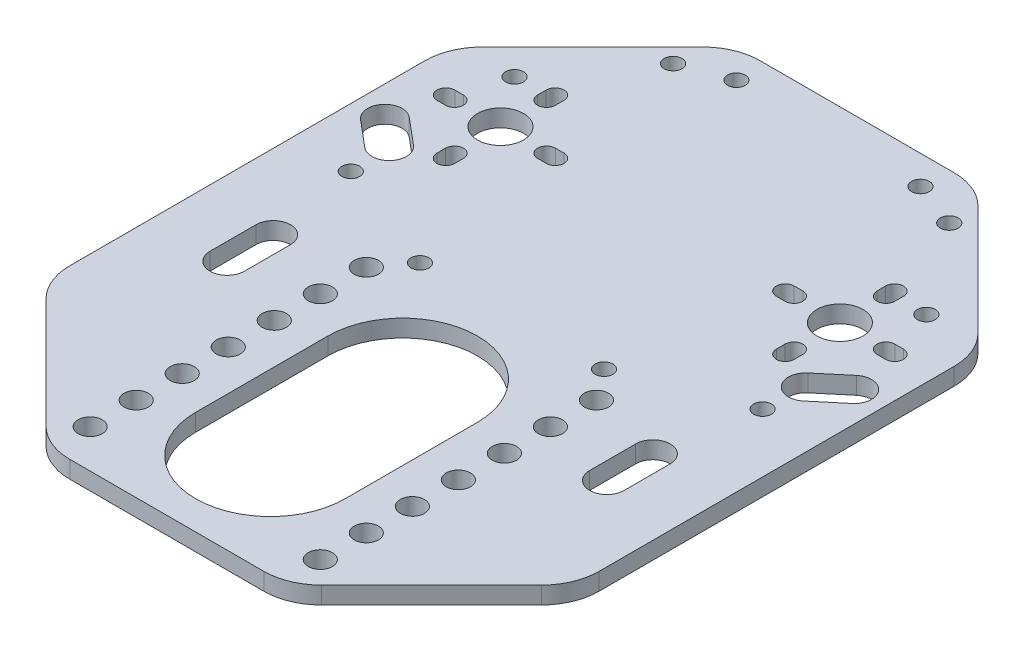
from build123d import *

# Parameters (mm, degrees)
SKETCH1_W           = 92
SKETCH1_H           = 186.23
SKETCH1_R           = 4
SKETCH1_R_2         = 1.55
BOSS_EXTRUDE1_DEPTH = 3
CHAMFER1_SIZE       = 25
FILLET1_R           = 10
SKETCH_2_R          = 2.1
CUT_EXTRUDE_2_DEPTH = 10
CUT_EXTRUDE_3_DEPTH = 10
CHAMFER_1_SIZE      = 25
FILLET_1_R          = 10
SKETCH_6_R          = 1.55
CUT_EXTRUDE_4_DEPTH = 10


with BuildPart() as part:
    # Sketch1 → Boss-Extrude1 (new body)
    with BuildSketch(Plane(origin=(0, 0, 0), x_dir=(1, 0, 0), z_dir=(0, 1, 0))):
        with Locations((0, -60.615)):
            Rectangle(SKETCH1_W, SKETCH1_H)
        with Locations((29.5, 0)):
            Circle(SKETCH1_R, mode=Mode.SUBTRACT)
        with Locations((-29.5, 0)):
            Circle(SKETCH1_R, mode=Mode.SUBTRACT)
        with Locations((16, 27.5)):
            Circle(SKETCH1_R_2, mode=Mode.SUBTRACT)
        with Locations((16, -27.5)):
            Circle(SKETCH1_R_2, mode=Mode.SUBTRACT)
        with Locations((-16, -27.5)):
            Circle(SKETCH1_R_2, mode=Mode.SUBTRACT)
        with Locations((-16, 27.5)):
            Circle(SKETCH1_R_2, mode=Mode.SUBTRACT)
        with Locations((40.79, -100.27)):
            Circle(SKETCH1_R_2, mode=Mode.SUBTRACT)
        with Locations((40.79, -128.73)):
            Circle(SKETCH1_R_2, mode=Mode.SUBTRACT)
        with Locations((-30.79, -128.73)):
            Circle(SKETCH1_R_2, mode=Mode.SUBTRACT)
        with Locations((-30.79, -100.27)):
            Circle(SKETCH1_R_2, mode=Mode.SUBTRACT)
        with Locations((24, 24.5)):
            Circle(SKETCH1_R_2, mode=Mode.SUBTRACT)
        with Locations((-24, 24.5)):
            Circle(SKETCH1_R_2, mode=Mode.SUBTRACT)
        with Locations((41, -146.73)):
            Circle(SKETCH1_R_2, mode=Mode.SUBTRACT)
        with Locations((-41, -146.73)):
            Circle(SKETCH1_R_2, mode=Mode.SUBTRACT)
        with BuildLine():
            Line((37.5, 1.55), (39, 1.55))
            ThreePointArc((39, 1.55), (40.55, 0), (39, -1.55))
            Line((39, -1.55), (37.5, -1.55))
            ThreePointArc((37.5, -1.55), (35.95, 0), (37.5, 1.55))
        make_face(mode=Mode.SUBTRACT)
        with BuildLine():
            Line((31.05, -8), (31.05, -9.5))
            ThreePointArc((31.05, -9.5), (29.5, -11.05), (27.95, -9.5))
            Line((27.95, -9.5), (27.95, -8))
            ThreePointArc((27.95, -8), (29.5, -6.45), (31.05, -8))
        make_face(mode=Mode.SUBTRACT)
        with BuildLine():
            Line((21.5, -1.55), (20, -1.55))
            ThreePointArc((20, -1.55), (18.45, 0), (20, 1.55))
            Line((20, 1.55), (21.5, 1.55))
            ThreePointArc((21.5, 1.55), (23.05, 0), (21.5, -1.55))
        make_face(mode=Mode.SUBTRACT)
        with BuildLine():
            Line((27.95, 8), (27.95, 9.5))
            ThreePointArc((27.95, 9.5), (29.5, 11.05), (31.05, 9.5))
            Line((31.05, 9.5), (31.05, 8))
            ThreePointArc((31.05, 8), (29.5, 6.45), (27.95, 8))
        make_face(mode=Mode.SUBTRACT)
        with BuildLine():
            Line((-27.95, 8), (-27.95, 9.5))
            ThreePointArc((-27.95, 9.5), (-29.5, 11.05), (-31.05, 9.5))
            Line((-31.05, 9.5), (-31.05, 8))
            ThreePointArc((-31.05, 8), (-29.5, 6.45), (-27.95, 8))
        make_face(mode=Mode.SUBTRACT)
        with BuildLine():
            Line((-21.5, -1.55), (-20, -1.55))
            ThreePointArc((-20, -1.55), (-18.45, 0), (-20, 1.55))
            Line((-20, 1.55), (-21.5, 1.55))
            ThreePointArc((-21.5, 1.55), (-23.05, 0), (-21.5, -1.55))
        make_face(mode=Mode.SUBTRACT)
        with BuildLine():
            Line((-31.05, -8), (-31.05, -9.5))
            ThreePointArc((-31.05, -9.5), (-29.5, -11.05), (-27.95, -9.5))
            Line((-27.95, -9.5), (-27.95, -8))
            ThreePointArc((-27.95, -8), (-29.5, -6.45), (-31.05, -8))
        make_face(mode=Mode.SUBTRACT)
        with BuildLine():
            Line((-37.5, 1.55), (-39, 1.55))
            ThreePointArc((-39, 1.55), (-40.55, 0), (-39, -1.55))
            Line((-39, -1.55), (-37.5, -1.55))
            ThreePointArc((-37.5, -1.55), (-35.95, 0), (-37.5, 1.55))
        make_face(mode=Mode.SUBTRACT)
        with BuildLine():
            Line((13, -46.5), (13, -69.5))
            ThreePointArc((13, -69.5), (0, -82.5), (-13, -69.5))
            Line((-13, -69.5), (-13, -46.5))
            ThreePointArc((-13, -46.5), (0, -33.5), (13, -46.5))
        make_face(mode=Mode.SUBTRACT)
        with BuildLine():
            Line((42.725522694, -11.094392704), (38.129256035, -14.951118362))
            ThreePointArc((38.129256035, -14.951118362), (33.902759877, -14.581347862), (34.272530377, -10.354851703))
            Line((34.272530377, -10.354851703), (38.868797036, -6.498126045))
            ThreePointArc((38.868797036, -6.498126045), (43.095293194, -6.867896546), (42.725522694, -11.094392704))
        make_face(mode=Mode.SUBTRACT)
        with BuildLine():
            Line((-42.725522694, -11.094392704), (-38.129256035, -14.951118362))
            ThreePointArc((-38.129256035, -14.951118362), (-33.902759877, -14.581347862), (-34.272530377, -10.354851703))
            Line((-34.272530377, -10.354851703), (-38.868797036, -6.498126045))
            ThreePointArc((-38.868797036, -6.498126045), (-43.095293194, -6.867896546), (-42.725522694, -11.094392704))
        make_face(mode=Mode.SUBTRACT)
        with BuildLine():
            Line((36, -36), (36, -44))
            ThreePointArc((36, -44), (33, -47), (30, -44))
            Line((30, -44), (30, -36))
            ThreePointArc((30, -36), (33, -33), (36, -36))
        make_face(mode=Mode.SUBTRACT)
        with BuildLine():
            Line((-36, -36), (-36, -44))
            ThreePointArc((-36, -44), (-33, -47), (-30, -44))
            Line((-30, -44), (-30, -36))
            ThreePointArc((-30, -36), (-33, -33), (-36, -36))
        make_face(mode=Mode.SUBTRACT)
        with BuildLine():
            Line((15, -148.18), (35, -148.18))
            ThreePointArc((35, -148.18), (36.55, -149.73), (35, -151.28))
            Line((35, -151.28), (15, -151.28))
            ThreePointArc((15, -151.28), (13.45, -149.73), (15, -148.18))
        make_face(mode=Mode.SUBTRACT)
        with BuildLine():
            Line((-15, -148.18), (-35, -148.18))
            ThreePointArc((-35, -148.18), (-36.55, -149.73), (-35, -151.28))
            Line((-35, -151.28), (-15, -151.28))
            ThreePointArc((-15, -151.28), (-13.45, -149.73), (-15, -148.18))
        make_face(mode=Mode.SUBTRACT)
    extrude(amount=BOSS_EXTRUDE1_DEPTH)

    # Chamfer1
    chamfer1_edges = [part.edges().sort_by_distance(p)[0] for p in [
        (46, 1.5, -32.5),
        (-46, 1.5, -32.5),
    ]]
    chamfer(chamfer1_edges, length=CHAMFER1_SIZE)

    # Fillet1
    fillet1_edges = [part.edges().sort_by_distance(p)[0] for p in [
        (-46, 1.5, 153.73),
        (46, 1.5, 153.73),
        (46, 1.5, -7.5),
        (21, 1.5, -32.5),
        (-46, 1.5, -7.5),
        (-21, 1.5, -32.5),
    ]]
    fillet(fillet1_edges, radius=FILLET1_R)

    # 草图2 → 切除-拉伸2 (cut)
    with BuildSketch(Plane(origin=(0, 3, 0), x_dir=(1, 0, 0), z_dir=(0, 1, 0))):
        with Locations((-20, -56.821452148)):
            Circle(SKETCH_2_R)
        with Locations((-20, -48.821452148)):
            Circle(SKETCH_2_R)
        with Locations((-20, -40.821452148)):
            Circle(SKETCH_2_R)
        with Locations((-20, -32.821452148)):
            Circle(SKETCH_2_R)
        with Locations((-20, -64.821452148)):
            Circle(SKETCH_2_R)
        with Locations((-20, -72.821452148)):
            Circle(SKETCH_2_R)
        with Locations((-20, -80.821452148)):
            Circle(SKETCH_2_R)
        with Locations((20, -80.821452148)):
            Circle(SKETCH_2_R)
        with Locations((20, -72.821452148)):
            Circle(SKETCH_2_R)
        with Locations((20, -64.821452148)):
            Circle(SKETCH_2_R)
        with Locations((20, -32.821452148)):
            Circle(SKETCH_2_R)
        with Locations((20, -40.821452148)):
            Circle(SKETCH_2_R)
        with Locations((20, -48.821452148)):
            Circle(SKETCH_2_R)
        with Locations((20, -56.821452148)):
            Circle(SKETCH_2_R)
    extrude(amount=-CUT_EXTRUDE_2_DEPTH, mode=Mode.SUBTRACT)

    # 草图5 → 切除-拉伸3 (cut)
    with BuildSketch(Plane(origin=(0, 3, 0), x_dir=(1, 0, 0), z_dir=(0, 1, 0))):
        with BuildLine():
            Line((46, -87.5), (-46, -87.5))
            Line((-46, -87.5), (-46, -143.73))
            ThreePointArc((-46, -143.73), (-43.071067812, -150.801067812), (-36, -153.73))
            Line((-36, -153.73), (36, -153.73))
            ThreePointArc((36, -153.73), (43.071067812, -150.801067812), (46, -143.73))
            Line((46, -143.73), (46, -87.5))
        make_face()
    extrude(amount=-CUT_EXTRUDE_3_DEPTH, mode=Mode.SUBTRACT)

    # 倒角1
    chamfer_1_edges = [part.edges().sort_by_distance(p)[0] for p in [
        (46, 1.5, 87.5),
        (-46, 1.5, 87.5),
    ]]
    chamfer(chamfer_1_edges, length=CHAMFER_1_SIZE)

    # 圆角1
    fillet_1_edges = [part.edges().sort_by_distance(p)[0] for p in [
        (46, 1.5, 62.5),
        (21, 1.5, 87.5),
        (-21, 1.5, 87.5),
        (-46, 1.5, 62.5),
    ]]
    fillet(fillet_1_edges, radius=FILLET_1_R)

    # 草图6 → 切除-拉伸4 (cut)
    with BuildSketch(Plane(origin=(0, 3, 0), x_dir=(1, 0, 0), z_dir=(0, 1, 0))):
        with Locations((-35.79, 8.73)):
            Circle(SKETCH_6_R)
        with Locations((35.79, 8.73)):
            Circle(SKETCH_6_R)
        with Locations((35.79, -19.73)):
            Circle(SKETCH_6_R)
        with Locations((-35.79, -19.73)):
            Circle(SKETCH_6_R)
    extrude(amount=-CUT_EXTRUDE_4_DEPTH, mode=Mode.SUBTRACT)


solid = part.part
